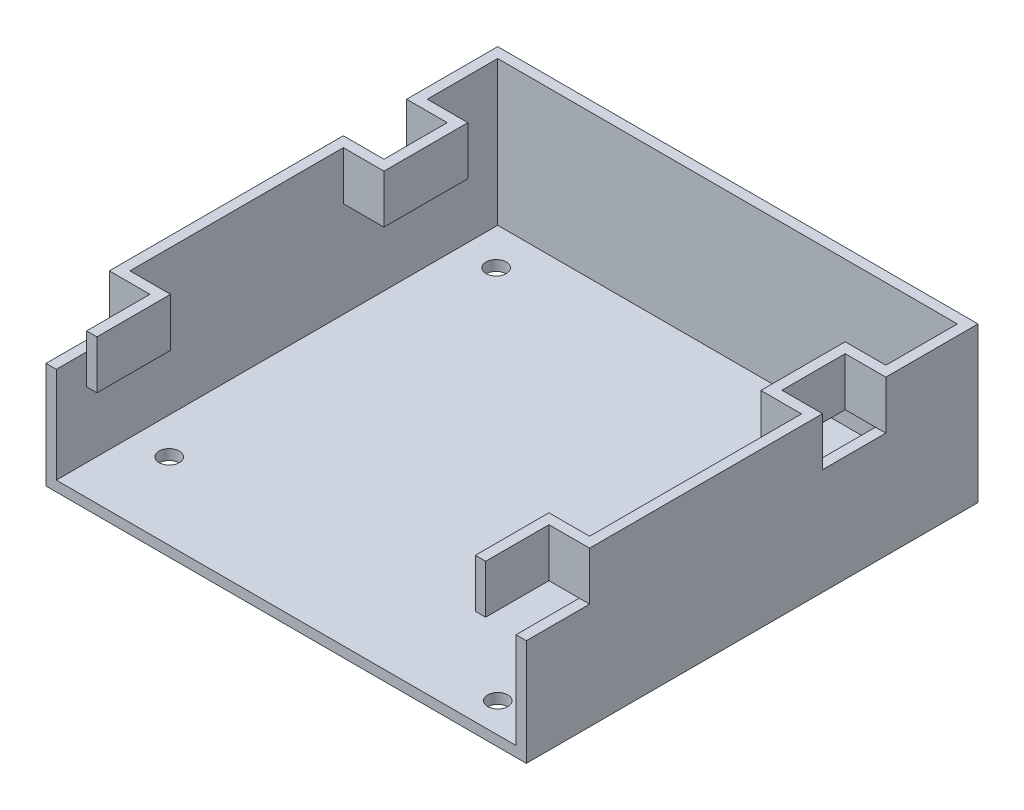
from build123d import *

# Parameters (mm, degrees)
SKETCH1_W           = 89.12
SKETCH1_H           = 85.57
BOSS_EXTRUDE1_DEPTH = 2
SKETCH3_W           = 2
SKETCH3_H           = 30
BOSS_EXTRUDE2_DEPTH = 85.57
SKETCH4_W           = 2
SKETCH4_H           = 30
BOSS_EXTRUDE3_DEPTH = 85.57
SKETCH5_W           = 93.12
SKETCH5_H           = 2
BOSS_EXTRUDE4_DEPTH = 30
SKETCH6_R           = 1.96
CUT_EXTRUDE2_DEPTH  = 30
SKETCH7_R           = 1.96
CUT_EXTRUDE3_DEPTH  = 30
SKETCH8_R           = 1.96
CUT_EXTRUDE4_DEPTH  = 30
SKETCH9_R           = 1.96
CUT_EXTRUDE5_DEPTH  = 30
BOSS_EXTRUDE5_DEPTH = 9.4
SKETCH12_W          = 2
SKETCH12_H          = 12.27
CUT_EXTRUDE6_DEPTH  = 9.4
BOSS_EXTRUDE6_DEPTH = 9.4
SKETCH14_W          = 2
SKETCH14_H          = 12.27
CUT_EXTRUDE7_DEPTH  = 9.4
BOSS_EXTRUDE7_DEPTH = 9.4
SKETCH16_W          = 2
SKETCH16_H          = 12.27
CUT_EXTRUDE8_DEPTH  = 9.4
BOSS_EXTRUDE8_DEPTH = 9.4
SKETCH18_W          = 2
SKETCH18_H          = 12.27
CUT_EXTRUDE9_DEPTH  = 9.4


with BuildPart() as part:
    # Sketch1 → Boss-Extrude1 (new body)
    with BuildSketch(Plane(origin=(0, 0, 0), x_dir=(1, 0, 0), z_dir=(0, 1, 0))):
        with Locations((44.56, 42.785)):
            Rectangle(SKETCH1_W, SKETCH1_H)
    extrude(amount=BOSS_EXTRUDE1_DEPTH)

    # Sketch3 → Boss-Extrude2 (add)
    with BuildSketch(Plane.XY):
        with Locations((-1, 15)):
            Rectangle(SKETCH3_W, SKETCH3_H)
    extrude(amount=-BOSS_EXTRUDE2_DEPTH)

    # Sketch4 → Boss-Extrude3 (add)
    with BuildSketch(Plane.XY):
        with Locations((90.12, 15)):
            Rectangle(SKETCH4_W, SKETCH4_H)
    extrude(amount=-BOSS_EXTRUDE3_DEPTH)

    # Sketch5 → Boss-Extrude4 (add)
    with BuildSketch(Plane(origin=(0, 0, 0), x_dir=(1, 0, 0), z_dir=(0, 1, 0))):
        with Locations((44.56, 86.57)):
            Rectangle(SKETCH5_W, SKETCH5_H)
    extrude(amount=BOSS_EXTRUDE4_DEPTH)

    # Sketch6 → Cut-Extrude2 (cut)
    with BuildSketch(Plane(origin=(0, 0, 0), x_dir=(1, 0, 0), z_dir=(0, 1, 0))):
        with Locations((79.835, 5.755)):
            Circle(SKETCH6_R)
    extrude(amount=CUT_EXTRUDE2_DEPTH, mode=Mode.SUBTRACT)

    # Sketch7 → Cut-Extrude3 (cut)
    with BuildSketch(Plane(origin=(0, 2, 0), x_dir=(1, 0, 0), z_dir=(0, 1, 0))):
        with Locations((82.285, 76.225)):
            Circle(SKETCH7_R)
    extrude(amount=-CUT_EXTRUDE3_DEPTH, mode=Mode.SUBTRACT)

    # Sketch8 → Cut-Extrude4 (cut)
    with BuildSketch(Plane(origin=(0, 0, 0), x_dir=(1, 0, 0), z_dir=(0, 1, 0))):
        with Locations((6.985, 78.28)):
            Circle(SKETCH8_R)
    extrude(amount=CUT_EXTRUDE4_DEPTH, mode=Mode.SUBTRACT)

    # Sketch9 → Cut-Extrude5 (cut)
    with BuildSketch(Plane(origin=(0, 2, 0), x_dir=(1, 0, 0), z_dir=(0, 1, 0))):
        with Locations((7.035, 14.85)):
            Circle(SKETCH9_R)
    extrude(amount=-CUT_EXTRUDE5_DEPTH, mode=Mode.SUBTRACT)

    # Sketch11 → Boss-Extrude5 (add)
    with BuildSketch(Plane(origin=(0, 30, 0), x_dir=(1, 0, 0), z_dir=(0, 1, 0))):
        Polygon((81.24, 0), (83.24, 0), (83.24, 12.27), (89.12, 12.27), (89.12, 14.27), (81.24, 14.27), align=None)
    extrude(amount=-BOSS_EXTRUDE5_DEPTH)

    # Sketch12 → Cut-Extrude6 (cut)
    with BuildSketch(Plane(origin=(0, 30, 0), x_dir=(1, 0, 0), z_dir=(0, 1, 0))):
        with Locations((90.12, 6.135)):
            Rectangle(SKETCH12_W, SKETCH12_H)
    extrude(amount=-CUT_EXTRUDE6_DEPTH, mode=Mode.SUBTRACT)

    # Sketch13 → Boss-Extrude6 (add)
    with BuildSketch(Plane(origin=(0, 30, 0), x_dir=(1, 0, 0), z_dir=(0, 1, 0))):
        Polygon((89.12, 55.359786784), (89.12, 57.43), (83.24, 57.43), (83.24, 69.7), (89.12, 69.7), (89.12, 71.7), (81.24, 71.7), (81.24, 55.359786784), align=None)
    extrude(amount=-BOSS_EXTRUDE6_DEPTH)

    # Sketch14 → Cut-Extrude7 (cut)
    with BuildSketch(Plane(origin=(0, 30, 0), x_dir=(1, 0, 0), z_dir=(0, 1, 0))):
        with Locations((90.12, 63.565)):
            Rectangle(SKETCH14_W, SKETCH14_H)
    extrude(amount=-CUT_EXTRUDE7_DEPTH, mode=Mode.SUBTRACT)

    # Sketch15 → Boss-Extrude7 (add)
    with BuildSketch(Plane(origin=(0, 30, 0), x_dir=(1, 0, 0), z_dir=(0, 1, 0))):
        Polygon((5.88, 57.64), (0, 57.64), (0, 55.64), (7.88, 55.64), (7.88, 71.91), (0, 71.91), (0, 69.91), (5.88, 69.91), align=None)
    extrude(amount=-BOSS_EXTRUDE7_DEPTH)

    # Sketch16 → Cut-Extrude8 (cut)
    with BuildSketch(Plane(origin=(0, 30, 0), x_dir=(1, 0, 0), z_dir=(0, 1, 0))):
        with Locations((-1, 63.775)):
            Rectangle(SKETCH16_W, SKETCH16_H)
    extrude(amount=-CUT_EXTRUDE8_DEPTH, mode=Mode.SUBTRACT)

    # Sketch17 → Boss-Extrude8 (add)
    with BuildSketch(Plane(origin=(0, 30, 0), x_dir=(1, 0, 0), z_dir=(0, 1, 0))):
        Polygon((5.88, 12.27), (5.88, 0), (7.88, 0), (7.88, 14.27), (0, 14.27), (0, 12.27), align=None)
    extrude(amount=-BOSS_EXTRUDE8_DEPTH)

    # Sketch18 → Cut-Extrude9 (cut)
    with BuildSketch(Plane(origin=(0, 30, 0), x_dir=(1, 0, 0), z_dir=(0, 1, 0))):
        with Locations((-1, 6.135)):
            Rectangle(SKETCH18_W, SKETCH18_H)
    extrude(amount=-CUT_EXTRUDE9_DEPTH, mode=Mode.SUBTRACT)


solid = part.part
